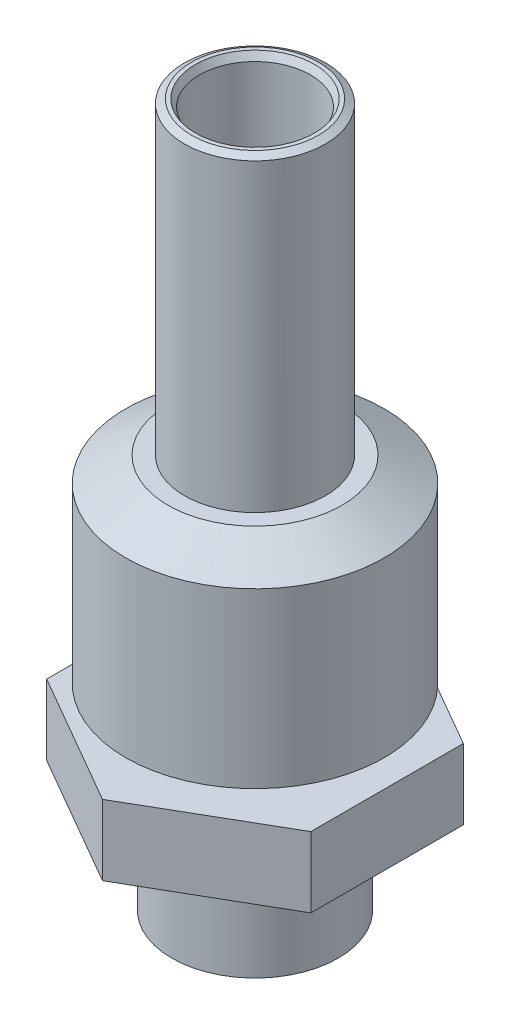
from build123d import *
from OCP.BRepFilletAPI import BRepFilletAPI_MakeChamfer

# Parameters (mm, degrees)
BOSS_EXTRUDE1_DEPTH = 27.432
CHAMFER1_SIZE       = 0.254
CHAMFER1_SIZE2      = 0.146646968


# Read off the part's stored shape, not the designer's step: Cut-Revolve4
with BuildPart() as part:
    # Sketch3 → Boss-Extrude1 (new body)
    with BuildSketch(Plane(origin=(0, 0, 0), x_dir=(1, 0, 0), z_dir=(0, 1, 0))):
        Polygon((4.7625, 2.749630657), (0, 5.499261314), (-4.7625, 2.749630657), (-4.7625, -2.749630657), (0, -5.499261314), (4.7625, -2.749630657), align=None)
    extrude(amount=BOSS_EXTRUDE1_DEPTH)

    # Cut-Revolve4 outline → Cut-Revolve4 (revolve, cut)
    with BuildSketch(Plane.XY):
        Polygon((4.6609, 9.18188181), (3.1369, 8.302), (5.499261314, 8.302), (5.499261314, 27.432), (2.54, 27.432), (2.54, 16.302), (3.1369, 16.302), (4.6609, 15.42211819), align=None)
        Polygon((0.99695, 21.082), (2, 21.082), (2, 27.432), (0, 27.432), (0, 1.391072642), (0.99695, 1.92116036), align=None)
    revolve(axis=Axis((0, 0, 0), (0, 1, 0)), mode=Mode.SUBTRACT)

    # Chamfer1: one chamfer whose edges measure the first distance from different faces: ONE call of the kernel's chamfer builder (chamfer() names one face for all edges)
    chamfer1_edges_1 = [part.edges().sort_by_distance(p)[0] for p in [
        (-2.54, 27.432, 0),
    ]]
    chamfer1_side_1 = [part.faces().sort_by_distance(p)[0] for p in [
        (-2.468157951, 27.432, 0),
    ]]
    chamfer1_edges_2 = [part.edges().sort_by_distance(p)[0] for p in [
        (-2, 27.432, 0),
    ]]
    chamfer1_side_2 = [part.faces().sort_by_distance(p)[0] for p in [
        (-2, 24.257, 0),
    ]]
    chamfer1 = BRepFilletAPI_MakeChamfer(part.part.solid().wrapped)
    for e in chamfer1_edges_1:
        chamfer1.Add(CHAMFER1_SIZE, CHAMFER1_SIZE2, e.wrapped, chamfer1_side_1[0].wrapped)  # the first distance lies on this face
    for e in chamfer1_edges_2:
        chamfer1.Add(CHAMFER1_SIZE, CHAMFER1_SIZE2, e.wrapped, chamfer1_side_2[0].wrapped)  # the first distance lies on this face
    add(Compound.cast(chamfer1.Shape()), mode=Mode.REPLACE)

    # Sketch4 → Cut-Revolve5 (revolve, cut)
    with BuildSketch(Plane.XY, mode=Mode.PRIVATE) as cut_revolve5_sk:
        Polygon((-0.25, 0.762), (-0.5, 0.762), (-3, 2.091273579), (-3, 5.762), (-6.107414125, 5.762), (-6.107414125, 0), (0, 0), (0, 1.524), (-0.25, 1.524), align=None)
    revolve(cut_revolve5_sk.sketch.rotate(Axis((0, 0, 0), (0, 1, 0)), 270), axis=Axis((0, 0, 0), (0, 1, 0)), mode=Mode.SUBTRACT)


solid = part.part
